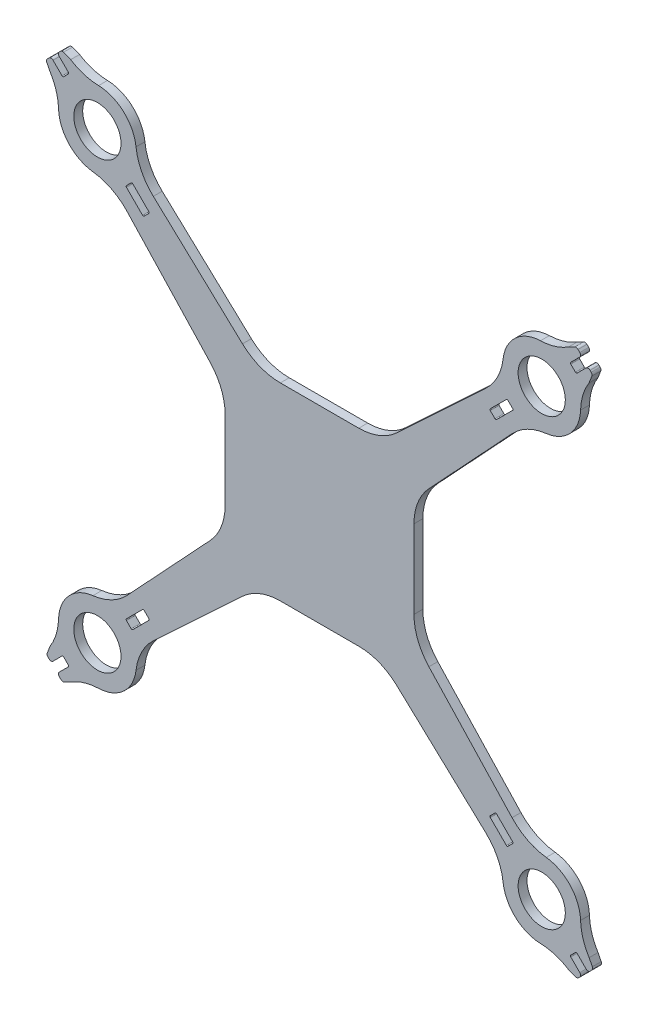
from build123d import *

# Parameters (mm, degrees)
SKETCH1_R                = 4.25
BOSS_EXTRUDE1_DEPTH      = 1.6
FILLET1_R                = 10
FILLET2_R                = 0.2
FILLET3_R                = 0.5
FILLET4_R                = 10
CIRPATTERN1_COUNT        = 4
FILLET1_OF_CIRPATTERN1_R = 10
FILLET2_OF_CIRPATTERN1_R = 0.2
FILLET3_OF_CIRPATTERN1_R = 0.5
FILLET4_OF_CIRPATTERN1_R = 10


with BuildPart() as part:
    # Sketch1 → Boss-Extrude1 (new body)
    with BuildSketch(Plane.XY):
        with BuildLine():
            Line((33.343119579, 37.835296079), (11, 17))
            Line((11, 17), (0, 17))
            Line((0, 17), (0, 0))
            Line((0, 0), (17, 0))
            Line((17, 0), (17, 11))
            Line((17, 11), (37.835296079, 33.343119579))
            ThreePointArc((37.835296079, 33.343119579), (45.119475911, 35.22601148), (46.489662482, 42.623791315))
            Line((46.489662482, 42.623791315), (48.535657562, 44.81785242))
            Line((48.535657562, 44.81785242), (49.141249344, 46.415099842))
            Line((49.141249344, 46.415099842), (48.343860018, 47.212489168))
            Line((48.343860018, 47.212489168), (46.222539674, 45.091168825))
            Line((46.222539674, 45.091168825), (45.091168825, 46.222539674))
            Line((45.091168825, 46.222539674), (47.212489168, 48.343860018))
            Line((47.212489168, 48.343860018), (46.275562097, 49.280787089))
            Line((46.275562097, 49.280787089), (44.81785242, 48.535657562))
            Line((44.81785242, 48.535657562), (42.623791315, 46.489662482))
            ThreePointArc((42.623791315, 46.489662482), (35.22601148, 45.119475911), (33.343119579, 37.835296079))
        make_face()
        Polygon((31.72685066, 30.59547981), (30.59547981, 31.72685066), (33.777460326, 34.908831175), (34.908831175, 33.777460326), align=None, mode=Mode.SUBTRACT)
        with Locations((40, 40)):
            Circle(SKETCH1_R, mode=Mode.SUBTRACT)
    boss_extrude1 = extrude(amount=BOSS_EXTRUDE1_DEPTH)

    # Fillet1
    fillet1_edges = [part.edges().sort_by_distance(p)[0] for p in [
        (17, 11, 0.8),
        (11, 17, 0.8),
    ]]
    fillet(fillet1_edges, radius=FILLET1_R)

    # Fillet2
    fillet2_edges = [part.edges().sort_by_distance(p)[0] for p in [
        (30.59547981, 31.72685066, 0.8),
        (31.72685066, 30.59547981, 0.8),
        (34.908831175, 33.777460326, 0.8),
        (33.777460326, 34.908831175, 0.8),
        (45.091168825, 46.222539674, 0.8),
        (46.222539674, 45.091168825, 0.8),
    ]]
    fillet(fillet2_edges, radius=FILLET2_R)

    # Fillet3
    fillet3_edges = [part.edges().sort_by_distance(p)[0] for p in [
        (46.275562097, 49.280787089, 0.8),
        (47.212489168, 48.343860018, 0.8),
        (48.343860018, 47.212489168, 0.8),
        (49.141249344, 46.415099842, 0.8),
    ]]
    fillet(fillet3_edges, radius=FILLET3_R)

    # Fillet4
    # the kernel refuses this fillet: 10 mm, written as the material it adds along each edge
    with BuildSketch(Plane(origin=(42.623791315, 46.489662482, 0), x_dir=(0.7313537016191648, 0.6819983600625047, 0), z_dir=(0, 0, 1))) as fillet4_piece_1:
        with BuildLine():
            CenterArc((4.863618399, 9.824811777), FILLET4_R, 228.751801144, 30.507657863)
            Line((-1.729603401, 2.306206435), (-1.861467837, 2.155834328))
            ThreePointArc((-1.861467837, 2.155834328), (-0.904800434, 1.123105059), (-0.181281676, -0.084480494))
            Line((-0.181281676, -0.084480494), (0, -0.2))
            ThreePointArc((0, -0.2), (1.5, -0.2), (2.962727632, -0.196496236))
            Line((2.962727632, -0.196496236), (3, 0))
        make_face()
    extrude(amount=1.6)
    with BuildSketch(Plane(origin=(46.489662482, 42.623791315, 0), x_dir=(0.6819983600624939, 0.7313537016191748, 0), z_dir=(0, 0, 1))) as fillet4_piece_2:
        with BuildLine():
            CenterArc((4.863618399, -9.824811777), FILLET4_R, 100.740540993, 30.507657863)
            Line((-1.729603401, -2.306206435), (-1.861467837, -2.155834328))
            ThreePointArc((-1.861467837, -2.155834328), (-0.904800434, -1.123105059), (-0.181281676, 0.084480494))
            Line((-0.181281676, 0.084480494), (0, 0.2))
            ThreePointArc((0, 0.2), (1.5, 0.2), (2.962727632, 0.196496236))
            Line((2.962727632, 0.196496236), (3, 0))
        make_face()
    extrude(amount=1.6)
    with BuildSketch(Plane(origin=(37.835296079, 33.343119579, 0), x_dir=(0.9950917812561543, -0.0989562877055012, 0), z_dir=(0, 0, 1))) as fillet4_piece_3:
        with BuildLine():
            CenterArc((5.126876251, -9.769168656), FILLET4_R, 102.334569166, 40.344502896)
            Line((-2.825644586, -3.7063795), (-2.984695002, -3.585123717))
            Line((-2.984695002, -3.585123717), (-0.159050417, 0.121255783))
            Line((-0.159050417, 0.121255783), (0.042723969, 0.195383373))
            ThreePointArc((0.042723969, 0.195383373), (1.495338906, 0.038418059), (2.947953844, 0.195383373))
            Line((2.947953844, 0.195383373), (2.990677813, 0))
        make_face()
    extrude(amount=1.6)
    with BuildSketch(Plane(origin=(33.343119579, 37.835296079, 0), x_dir=(-0.09895628770552686, 0.9950917812561518, 0), z_dir=(0, 0, 1))) as fillet4_piece_4:
        with BuildLine():
            CenterArc((5.126876251, 9.769168656), FILLET4_R, 217.320927938, 40.344502896)
            Line((-2.825644586, 3.7063795), (-2.984695002, 3.585123717))
            Line((-2.984695002, 3.585123717), (-0.159050417, -0.121255783))
            Line((-0.159050417, -0.121255783), (0.042723969, -0.195383373))
            ThreePointArc((0.042723969, -0.195383373), (1.495338906, -0.038418059), (2.947953844, -0.195383373))
            Line((2.947953844, -0.195383373), (2.990677813, 0))
        make_face()
    extrude(amount=1.6)

    # CirPattern1: Boss-Extrude1 ×4 about axis
    cirpattern1_axis = Axis((0, 0, 0), (0, 0, 1))
    for i in range(1, CIRPATTERN1_COUNT):
        add(boss_extrude1.rotate(cirpattern1_axis, i * 360 / CIRPATTERN1_COUNT))

    # Fillet1 of CirPattern1
    fillet1_of_cirpattern1_edges = [part.edges().sort_by_distance(p)[0] for p in [
        (-11, 17, 0.8),
        (-17, 11, 0.8),
        (-17, -11, 0.8),
        (-11, -17, 0.8),
        (11, -17, 0.8),
        (17, -11, 0.8),
    ]]
    fillet(fillet1_of_cirpattern1_edges, radius=FILLET1_OF_CIRPATTERN1_R)

    # Fillet2 of CirPattern1
    fillet2_of_cirpattern1_edges = [part.edges().sort_by_distance(p)[0] for p in [
        (-31.72685066, 30.59547981, 0.8),
        (-30.59547981, 31.72685066, 0.8),
        (-33.777460326, 34.908831175, 0.8),
        (-34.908831175, 33.777460326, 0.8),
        (-46.222539674, 45.091168825, 0.8),
        (-45.091168825, 46.222539674, 0.8),
        (-30.59547981, -31.72685066, 0.8),
        (-31.72685066, -30.59547981, 0.8),
        (-34.908831175, -33.777460326, 0.8),
        (-33.777460326, -34.908831175, 0.8),
        (-45.091168825, -46.222539674, 0.8),
        (-46.222539674, -45.091168825, 0.8),
        (31.72685066, -30.59547981, 0.8),
        (30.59547981, -31.72685066, 0.8),
        (33.777460326, -34.908831175, 0.8),
        (34.908831175, -33.777460326, 0.8),
        (46.222539674, -45.091168825, 0.8),
        (45.091168825, -46.222539674, 0.8),
    ]]
    fillet(fillet2_of_cirpattern1_edges, radius=FILLET2_OF_CIRPATTERN1_R)

    # Fillet3 of CirPattern1
    fillet3_of_cirpattern1_edges = [part.edges().sort_by_distance(p)[0] for p in [
        (-49.280787089, 46.275562097, 0.8),
        (-48.343860018, 47.212489168, 0.8),
        (-47.212489168, 48.343860018, 0.8),
        (-46.415099842, 49.141249344, 0.8),
        (-46.275562097, -49.280787089, 0.8),
        (-47.212489168, -48.343860018, 0.8),
        (-48.343860018, -47.212489168, 0.8),
        (-49.141249344, -46.415099842, 0.8),
        (49.280787089, -46.275562097, 0.8),
        (48.343860018, -47.212489168, 0.8),
        (47.212489168, -48.343860018, 0.8),
        (46.415099842, -49.141249344, 0.8),
    ]]
    fillet(fillet3_of_cirpattern1_edges, radius=FILLET3_OF_CIRPATTERN1_R)

    # Fillet4 of CirPattern1
    # the kernel refuses this fillet: 10 mm, written as the material it adds along each edge
    with BuildSketch(Plane(origin=(-46.489662482, 42.623791315, 0), x_dir=(-0.17589799409998233, -0.9844083988221568, 0), z_dir=(0, 0, 1)), Plane(origin=(-42.623791315, -46.489662482, 0), x_dir=(0.9844083988221568, -0.1758979940999819, 0), z_dir=(0, 0, 1))) as fillet4_of_cirpattern1_piece_1:
        with BuildLine():
            CenterArc((4.941818038, -9.785711261), FILLET4_OF_CIRPATTERN1_R, 101.882721186, 30.507657863)
            Line((-1.799965749, -2.400025688), (-1.934801424, -2.252311977))
            ThreePointArc((-1.934801424, -2.252311977), (-1.059984587, -1.080015128), (-0.160001713, 0.119997717))
            Line((-0.160001713, 0.119997717), (0.041181817, 0.195714225))
            ThreePointArc((0.041181817, 0.195714225), (1.441363594, 0.049997882), (2.841545372, 0.195714225))
            Line((2.841545372, 0.195714225), (2.882727189, 0))
        make_face()
    extrude(amount=1.6)
    with BuildSketch(Plane(origin=(-42.623791315, 46.489662482, 0), x_dir=(0.9844083988221527, 0.17589799410000626, 0), z_dir=(0, 0, 1))) as fillet4_of_cirpattern1_piece_2:
        with BuildLine():
            CenterArc((4.941818038, 9.785711261), FILLET4_OF_CIRPATTERN1_R, 227.609620952, 30.507657863)
            Line((-1.799965749, 2.400025688), (-1.934801424, 2.252311977))
            ThreePointArc((-1.934801424, 2.252311977), (-1.059984587, 1.080015128), (-0.160001713, -0.119997717))
            Line((-0.160001713, -0.119997717), (0.041181817, -0.195714225))
            ThreePointArc((0.041181817, -0.195714225), (1.441363594, -0.049997882), (2.841545372, -0.195714225))
            Line((2.841545372, -0.195714225), (2.882727189, 0))
        make_face()
    extrude(amount=1.6)
    with BuildSketch(Plane(origin=(-33.343119579, 37.835296079, 0), x_dir=(0.731353701619165, -0.6819983600625042, 0), z_dir=(0, 0, 1))) as fillet4_of_cirpattern1_piece_3:
        with BuildLine():
            CenterArc((4.660634755, 10), FILLET4_OF_CIRPATTERN1_R, 229.655497104, 40.344502896)
            Line((-1.813184901, 2.378342762), (-1.942661294, 2.225909617))
            ThreePointArc((-1.942661294, 2.225909617), (-0.937144492, 1.165879322), (-0.181281676, -0.084480494))
            Line((-0.181281676, -0.084480494), (0, -0.2))
            Line((0, -0.2), (4.660634755, -0.2))
            Line((4.660634755, -0.2), (4.660634755, 0))
        make_face()
    extrude(amount=1.6)
    with BuildSketch(Plane(origin=(-37.835296079, 33.343119579, 0), x_dir=(0.6819983600625028, -0.7313537016191666, 0), z_dir=(0, 0, 1)), Plane(origin=(-33.343119579, -37.835296079, 0), x_dir=(0.7313537016191666, 0.6819983600625028, 0), z_dir=(0, 0, 1))) as fillet4_of_cirpattern1_piece_4:
        with BuildLine():
            CenterArc((4.660634755, -10), FILLET4_OF_CIRPATTERN1_R, 90, 40.344502896)
            Line((-1.813184901, -2.378342762), (-1.942661294, -2.225909617))
            ThreePointArc((-1.942661294, -2.225909617), (-0.937144492, -1.165879322), (-0.181281676, 0.084480494))
            Line((-0.181281676, 0.084480494), (0, 0.2))
            Line((0, 0.2), (4.660634755, 0.2))
            Line((4.660634755, 0.2), (4.660634755, 0))
        make_face()
    extrude(amount=1.6)
    with BuildSketch(Plane(origin=(-46.489662482, -42.623791315, 0), x_dir=(-0.6819983600624939, -0.7313537016191748, 0), z_dir=(0, 0, 1)), Plane(origin=(42.623791315, -46.489662482, 0), x_dir=(0.7313537016191725, -0.6819983600624963, 0), z_dir=(0, 0, 1))) as fillet4_of_cirpattern1_piece_5:
        with BuildLine():
            CenterArc((4.863618399, -9.824811777), FILLET4_OF_CIRPATTERN1_R, 100.740540993, 30.507657863)
            Line((-1.729603401, -2.306206435), (-1.861467837, -2.155834328))
            ThreePointArc((-1.861467837, -2.155834328), (-0.904800434, -1.123105059), (-0.181281676, 0.084480494))
            Line((-0.181281676, 0.084480494), (0, 0.2))
            ThreePointArc((0, 0.2), (1.5, 0.2), (2.962727632, 0.196496236))
            Line((2.962727632, 0.196496236), (3, 0))
        make_face()
    extrude(amount=1.6)
    with BuildSketch(Plane(origin=(-37.835296079, -33.343119579, 0), x_dir=(-0.9950917812561543, 0.0989562877055012, 0), z_dir=(0, 0, 1)), Plane(origin=(33.343119579, -37.835296079, 0), x_dir=(-0.0989562877055012, -0.9950917812561543, 0), z_dir=(0, 0, 1))) as fillet4_of_cirpattern1_piece_6:
        with BuildLine():
            CenterArc((5.126876251, -9.769168656), FILLET4_OF_CIRPATTERN1_R, 102.334569166, 40.344502896)
            Line((-2.825644586, -3.7063795), (-2.984695002, -3.585123717))
            Line((-2.984695002, -3.585123717), (-0.159050417, 0.121255783))
            Line((-0.159050417, 0.121255783), (0.042723969, 0.195383373))
            ThreePointArc((0.042723969, 0.195383373), (1.495338906, 0.038418059), (2.947953844, 0.195383373))
            Line((2.947953844, 0.195383373), (2.990677813, 0))
        make_face()
    extrude(amount=1.6)
    with BuildSketch(Plane(origin=(46.489662482, -42.623791315, 0), x_dir=(0.6819983600625023, -0.7313537016191669, 0), z_dir=(0, 0, 1))) as fillet4_of_cirpattern1_piece_7:
        with BuildLine():
            CenterArc((4.863618399, 9.824811777), FILLET4_OF_CIRPATTERN1_R, 228.751801144, 30.507657863)
            Line((-1.729603401, 2.306206435), (-1.861467837, 2.155834328))
            ThreePointArc((-1.861467837, 2.155834328), (-0.904800434, 1.123105059), (-0.181281676, -0.084480494))
            Line((-0.181281676, -0.084480494), (0, -0.2))
            ThreePointArc((0, -0.2), (1.5, -0.2), (2.962727632, -0.196496236))
            Line((2.962727632, -0.196496236), (3, 0))
        make_face()
    extrude(amount=1.6)
    with BuildSketch(Plane(origin=(37.835296079, -33.343119579, 0), x_dir=(0.9950917812561518, 0.09895628770552686, 0), z_dir=(0, 0, 1))) as fillet4_of_cirpattern1_piece_8:
        with BuildLine():
            CenterArc((5.126876251, 9.769168656), FILLET4_OF_CIRPATTERN1_R, 217.320927938, 40.344502896)
            Line((-2.825644586, 3.7063795), (-2.984695002, 3.585123717))
            Line((-2.984695002, 3.585123717), (-0.159050417, -0.121255783))
            Line((-0.159050417, -0.121255783), (0.042723969, -0.195383373))
            ThreePointArc((0.042723969, -0.195383373), (1.495338906, -0.038418059), (2.947953844, -0.195383373))
            Line((2.947953844, -0.195383373), (2.990677813, 0))
        make_face()
    extrude(amount=1.6)


solid = part.part
